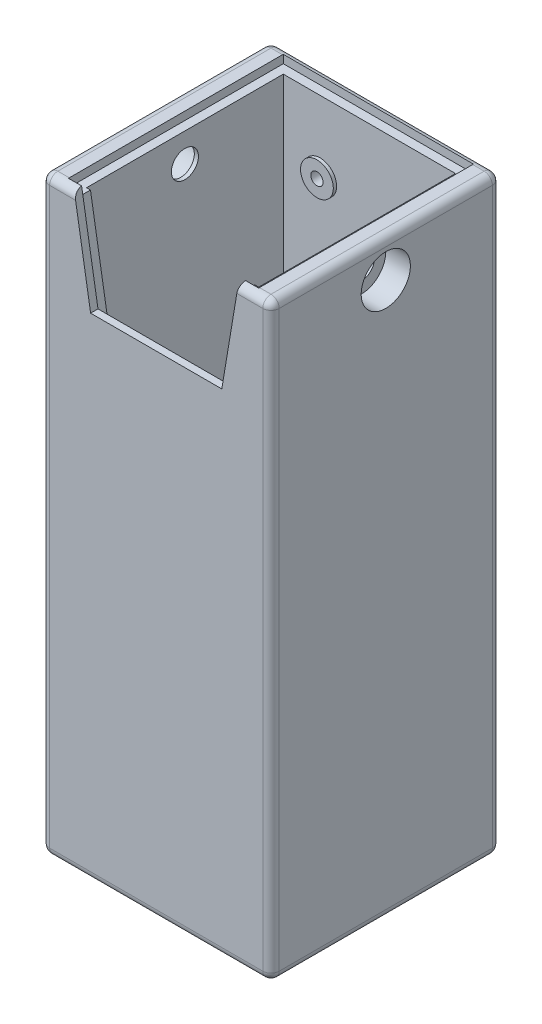
from build123d import *

# Parameters (mm, degrees)
SKIZZE1_W                        = 28
SKIZZE1_H                        = 28
AUFSATZ_LINEAR_AUSTRAGEN1_DEPTH  = 72
SKIZZE2_W                        = 12.2
SKIZZE2_H                        = 10.2
SCHNITT_LINEAR_AUSTRAGEN1_DEPTH  = 53
SKIZZE3_W                        = 21
SKIZZE3_H                        = 24
SCHNITT_LINEAR_AUSTRAGEN2_DEPTH  = 44
SKIZZE6_R                        = 1.25
SCHNITT_LINEAR_AUSTRAGEN4_DEPTH  = 6
SCHNITT_LINEAR_AUSTRAGEN13_DEPTH = 2
SKIZZE7_W                        = 23.2
SKIZZE7_H                        = 26.2
SCHNITT_LINEAR_AUSTRAGEN5_DEPTH  = 1
SCHNITT_LINEAR_AUSTRAGEN14_DEPTH = 1.1
SKIZZE13_R                       = 3
SCHNITT_LINEAR_AUSTRAGEN11_DEPTH = 3
SCHNITT_LINEAR_START             = -3
SKIZZE11_R                       = 3
SCHNITT_LINEAR_AUSTRAGEN9_DEPTH  = 3
SKIZZE12_R                       = 1.625
SCHNITT_LINEAR_AUSTRAGEN10_DEPTH = 0.5
SKIZZE14_R                       = 1.65
SCHNITT_LINEAR_AUSTRAGEN12_DEPTH = 0.5
SKIZZE18_R                       = 2
AUFSATZ_LINEAR_AUSTRAGEN2_DEPTH  = 0.4
SKIZZE19_R                       = 0.75
SCHNITT_LINEAR_AUSTRAGEN15_DEPTH = 1.6
KREISMUSTER1_COUNT               = 4
VERRUNDUNG1_R                    = 1


with BuildPart() as part:
    # Skizze1 → Aufsatz-Linear austragen1 (new body)
    with BuildSketch(Plane(origin=(0, 0, 0), x_dir=(1, 0, 0), z_dir=(0, 1, 0))):
        Rectangle(SKIZZE1_W, SKIZZE1_H)
    extrude(amount=AUFSATZ_LINEAR_AUSTRAGEN1_DEPTH)

    # Skizze2 → Schnitt-Linear austragen1 (cut)
    with BuildSketch(Plane(origin=(0, 72, 0), x_dir=(1, 0, 0), z_dir=(0, 1, 0))):
        Rectangle(SKIZZE2_W, SKIZZE2_H)
    extrude(amount=-SCHNITT_LINEAR_AUSTRAGEN1_DEPTH, mode=Mode.SUBTRACT)

    # Skizze3 → Schnitt-Linear austragen2 (cut)
    with BuildSketch(Plane(origin=(0, 72, 0), x_dir=(1, 0, 0), z_dir=(0, 1, 0))):
        Rectangle(SKIZZE3_W, SKIZZE3_H)
    extrude(amount=-SCHNITT_LINEAR_AUSTRAGEN2_DEPTH, mode=Mode.SUBTRACT)

    # Skizze5 → Schnitt-Rotation1 (revolve, cut)
    with BuildSketch(Plane.XY, mode=Mode.PRIVATE) as schnitt_rotation1_sk:
        Polygon((-3, 0), (-3, 8), (-4.1, 8), (-4.1, 19), (0, 19), (0, 0), align=None)
    revolve(schnitt_rotation1_sk.sketch.rotate(Axis((0, 0, 0), (0, 1, 0)), 270), axis=Axis((0, 0, 0), (0, 1, 0)), mode=Mode.SUBTRACT)

    # Skizze6 → Schnitt-Linear austragen4 (cut)
    with BuildSketch(Plane(origin=(0, 28, 0), x_dir=(1, 0, 0), z_dir=(0, 1, 0))):
        with Locations(Location((7.9, 4.6, 0), (0, 0, 270))):
            Circle(SKIZZE6_R)
        with Locations(Location((-7.9, -4.6, 0), (0, 0, 270))):
            Circle(SKIZZE6_R)
    extrude(amount=-SCHNITT_LINEAR_AUSTRAGEN4_DEPTH, mode=Mode.SUBTRACT)

    # Skizze15 → Schnitt-Linear austragen13 (cut)
    with BuildSketch(Plane.XY.offset(14)):
        Polygon((10, 72), (-10, 72), (-8, 60), (8, 60), align=None)
    extrude(amount=-SCHNITT_LINEAR_AUSTRAGEN13_DEPTH, mode=Mode.SUBTRACT)

    # Skizze7 → Schnitt-Linear austragen5 (cut)
    with BuildSketch(Plane(origin=(0, 72, 0), x_dir=(1, 0, 0), z_dir=(0, 1, 0))):
        Rectangle(SKIZZE7_W, SKIZZE7_H)
    extrude(amount=-SCHNITT_LINEAR_AUSTRAGEN5_DEPTH, mode=Mode.SUBTRACT)

    # Skizze17 → Schnitt-Linear austragen14 (cut)
    with BuildSketch(Plane(origin=(0, 0, 12), x_dir=(-1, 0, 0), z_dir=(0, 0, -1))):
        Polygon((-8, 58.9), (-10.016666667, 71), (-9.833333333, 71), (-8, 60), (8, 60), (9.833333333, 71), (10.016666667, 71), (8, 58.9), align=None)
    extrude(amount=-SCHNITT_LINEAR_AUSTRAGEN14_DEPTH, mode=Mode.SUBTRACT)

    # Skizze13 → Schnitt-Linear austragen11 (cut)
    with BuildSketch(Plane.ZY.offset(14)):
        with Locations((0, 67.5)):
            Circle(SKIZZE13_R)
    extrude(amount=-SCHNITT_LINEAR_AUSTRAGEN11_DEPTH, mode=Mode.SUBTRACT)

    # Skizze11 → Schnitt-Linear austragen9 (cut)
    with BuildSketch(Plane(origin=(14, 0, 0), x_dir=(0, 0, -1), z_dir=(1, 0, 0)).offset(SCHNITT_LINEAR_START)):
        with Locations(Location((0, 67.5, 0), (0, 0, 180))):
            Circle(SKIZZE11_R)
    extrude(amount=SCHNITT_LINEAR_AUSTRAGEN9_DEPTH, mode=Mode.SUBTRACT)

    # Skizze12 → Schnitt-Linear austragen10 (cut)
    with BuildSketch(Plane(origin=(11, 0, 0), x_dir=(0, 0, -1), z_dir=(1, 0, 0))):
        with Locations((0, 67.5)):
            Circle(SKIZZE12_R)
    extrude(amount=-SCHNITT_LINEAR_AUSTRAGEN10_DEPTH, mode=Mode.SUBTRACT)

    # Skizze14 → Schnitt-Linear austragen12 (cut)
    with BuildSketch(Plane.ZY.offset(11)):
        with Locations((0, 67.5)):
            Circle(SKIZZE14_R)
    extrude(amount=-SCHNITT_LINEAR_AUSTRAGEN12_DEPTH, mode=Mode.SUBTRACT)

    # Skizze18 → Aufsatz-Linear austragen2 (add)
    with BuildSketch(Plane.XY.offset(-12)):
        with Locations(Location((-6, 62.4, 0), (0, 0, 180))):
            Circle(SKIZZE18_R)
        with Locations(Location((6, 62.4, 0), (0, 0, 180))):
            Circle(SKIZZE18_R)
    extrude(amount=AUFSATZ_LINEAR_AUSTRAGEN2_DEPTH)

    # Skizze19 → Schnitt-Linear austragen15 (cut)
    with BuildSketch(Plane.XY.offset(-11.6)):
        with Locations((-6, 62.4)):
            Circle(SKIZZE19_R)
        with Locations((6, 62.4)):
            Circle(SKIZZE19_R)
    extrude(amount=-SCHNITT_LINEAR_AUSTRAGEN15_DEPTH, mode=Mode.SUBTRACT)

    # Skizze20 → Schnitt-Rotation2 (revolve, cut)
    with BuildSketch(Plane.XY, mode=Mode.PRIVATE) as schnitt_rotation2_sk:
        Polygon((-4.95, 0), (-4.95, 0.8), (-5.45, 0.8), (-5.45, 7), (-4.95, 7), (-4.95, 8.2), (-8, 8.2), (-8, 0), align=None)
    schnitt_rotation2 = revolve(schnitt_rotation2_sk.sketch.rotate(Axis((-8, 8.2, 0), (0, -1, 0)), 90), axis=Axis((-8, 8.2, 0), (0, -1, 0)), mode=Mode.SUBTRACT)

    # Kreismuster1: Schnitt-Rotation2 ×4 about axis
    kreismuster1_axis = Axis((0, 0, 0), (0, 1, 0))
    for i in range(1, KREISMUSTER1_COUNT):
        add(schnitt_rotation2.rotate(kreismuster1_axis, i * 360 / KREISMUSTER1_COUNT), mode=Mode.SUBTRACT)

    # Verrundung1
    # the kernel refuses this fillet: 1 mm, written as the material it takes off along each edge
    with BuildSketch(Plane(origin=(-13, 1, -13), x_dir=(-1, 0, 0), z_dir=(0, 0, -1))) as verrundung1_piece_1_section:
        Polygon((0, 0), (VERRUNDUNG1_R, 0), (VERRUNDUNG1_R, -VERRUNDUNG1_R), (0, -VERRUNDUNG1_R), align=None)
    verrundung1_piece_1 = extrude(amount=VERRUNDUNG1_R, mode=Mode.PRIVATE)
    verrundung1_piece_1 = verrundung1_piece_1 - Plane(origin=(-13, 1, -13), x_dir=(0.7071067811865475, 0.7071067811865475, 0), z_dir=(0, 0, -1)) * Sphere(VERRUNDUNG1_R, mode=Mode.PRIVATE)
    add(verrundung1_piece_1, mode=Mode.SUBTRACT)
    with BuildSketch(Plane(origin=(-13, 1, 13), x_dir=(0, -1, 0), z_dir=(-1, 0, 0))) as verrundung1_piece_2_section:
        Polygon((0, 0), (VERRUNDUNG1_R, 0), (VERRUNDUNG1_R, VERRUNDUNG1_R), (0, VERRUNDUNG1_R), align=None)
    verrundung1_piece_2 = extrude(amount=VERRUNDUNG1_R, mode=Mode.PRIVATE)
    verrundung1_piece_2 = verrundung1_piece_2 - Plane(origin=(-13, 1, 13), x_dir=(0, 0.7071067811865475, -0.7071067811865475), z_dir=(-1, 0, 0)) * Sphere(VERRUNDUNG1_R, mode=Mode.PRIVATE)
    add(verrundung1_piece_2, mode=Mode.SUBTRACT)
    with BuildSketch(Plane(origin=(13, 1, 13), x_dir=(0, -1, 0), z_dir=(1, 0, 0))) as verrundung1_piece_3_section:
        Polygon((0, 0), (VERRUNDUNG1_R, 0), (VERRUNDUNG1_R, -VERRUNDUNG1_R), (0, -VERRUNDUNG1_R), align=None)
    verrundung1_piece_3 = extrude(amount=VERRUNDUNG1_R, mode=Mode.PRIVATE)
    verrundung1_piece_3 = verrundung1_piece_3 - Plane(origin=(13, 1, 13), x_dir=(0, 0.7071067811865475, -0.7071067811865475), z_dir=(1, 0, 0)) * Sphere(VERRUNDUNG1_R, mode=Mode.PRIVATE)
    add(verrundung1_piece_3, mode=Mode.SUBTRACT)
    with BuildSketch(Plane(origin=(13, 1, -13), x_dir=(1, 0, 0), z_dir=(0, 0, -1))) as verrundung1_piece_4_section:
        Polygon((0, 0), (VERRUNDUNG1_R, 0), (VERRUNDUNG1_R, VERRUNDUNG1_R), (0, VERRUNDUNG1_R), align=None)
    verrundung1_piece_4 = extrude(amount=VERRUNDUNG1_R, mode=Mode.PRIVATE)
    verrundung1_piece_4 = verrundung1_piece_4 - Plane(origin=(13, 1, -13), x_dir=(-0.7071067811865475, 0.7071067811865475, 0), z_dir=(0, 0, -1)) * Sphere(VERRUNDUNG1_R, mode=Mode.PRIVATE)
    add(verrundung1_piece_4, mode=Mode.SUBTRACT)
    with BuildSketch(Plane(origin=(13, 71, 13), x_dir=(0, 1, 0), z_dir=(1, 0, 0))) as verrundung1_piece_5_section:
        Polygon((0, 0), (VERRUNDUNG1_R, 0), (VERRUNDUNG1_R, VERRUNDUNG1_R), (0, VERRUNDUNG1_R), align=None)
    verrundung1_piece_5 = extrude(amount=VERRUNDUNG1_R, mode=Mode.PRIVATE)
    verrundung1_piece_5 = verrundung1_piece_5 - Plane(origin=(13, 71, 13), x_dir=(0, -0.7071067811865475, -0.7071067811865475), z_dir=(1, 0, 0)) * Sphere(VERRUNDUNG1_R, mode=Mode.PRIVATE)
    add(verrundung1_piece_5, mode=Mode.SUBTRACT)
    with BuildSketch(Plane(origin=(13, 71, -13), x_dir=(1, 0, 0), z_dir=(0, 0, -1))) as verrundung1_piece_6_section:
        Polygon((0, 0), (VERRUNDUNG1_R, 0), (VERRUNDUNG1_R, -VERRUNDUNG1_R), (0, -VERRUNDUNG1_R), align=None)
    verrundung1_piece_6 = extrude(amount=VERRUNDUNG1_R, mode=Mode.PRIVATE)
    verrundung1_piece_6 = verrundung1_piece_6 - Plane(origin=(13, 71, -13), x_dir=(-0.7071067811865475, -0.7071067811865475, 0), z_dir=(0, 0, -1)) * Sphere(VERRUNDUNG1_R, mode=Mode.PRIVATE)
    add(verrundung1_piece_6, mode=Mode.SUBTRACT)
    with BuildSketch(Plane(origin=(-13, 71, -13), x_dir=(-1, 0, 0), z_dir=(0, 0, -1))) as verrundung1_piece_7_section:
        Polygon((0, 0), (VERRUNDUNG1_R, 0), (VERRUNDUNG1_R, VERRUNDUNG1_R), (0, VERRUNDUNG1_R), align=None)
    verrundung1_piece_7 = extrude(amount=VERRUNDUNG1_R, mode=Mode.PRIVATE)
    verrundung1_piece_7 = verrundung1_piece_7 - Plane(origin=(-13, 71, -13), x_dir=(0.7071067811865475, -0.7071067811865475, 0), z_dir=(0, 0, -1)) * Sphere(VERRUNDUNG1_R, mode=Mode.PRIVATE)
    add(verrundung1_piece_7, mode=Mode.SUBTRACT)
    with BuildSketch(Plane(origin=(-13, 71, 13), x_dir=(0, 1, 0), z_dir=(-1, 0, 0))) as verrundung1_piece_8_section:
        Polygon((0, 0), (VERRUNDUNG1_R, 0), (VERRUNDUNG1_R, -VERRUNDUNG1_R), (0, -VERRUNDUNG1_R), align=None)
    verrundung1_piece_8 = extrude(amount=VERRUNDUNG1_R, mode=Mode.PRIVATE)
    verrundung1_piece_8 = verrundung1_piece_8 - Plane(origin=(-13, 71, 13), x_dir=(0, -0.7071067811865475, -0.7071067811865475), z_dir=(-1, 0, 0)) * Sphere(VERRUNDUNG1_R, mode=Mode.PRIVATE)
    add(verrundung1_piece_8, mode=Mode.SUBTRACT)
    with BuildSketch(Plane(origin=(-14, 0, -13), x_dir=(0, 1, 0), z_dir=(0, 0, 1)), Plane(origin=(14, 0, 13), x_dir=(0, 1, 0), z_dir=(0, 0, -1)), Plane(origin=(13, 0, -14), x_dir=(0, 1, 0), z_dir=(-1, 0, 0))) as verrundung1_piece_9:
        with BuildLine():
            CenterArc((VERRUNDUNG1_R, -VERRUNDUNG1_R), VERRUNDUNG1_R, 90, 90)
            Line((0, -VERRUNDUNG1_R), (0, 0))
            Line((0, 0), (VERRUNDUNG1_R, 0))
        make_face()
    extrude(amount=26, mode=Mode.SUBTRACT)
    with BuildSketch(Plane(origin=(-13, 0, 14), x_dir=(0, 0, -1), z_dir=(1, 0, 0)), Plane(origin=(13, 72, -14), x_dir=(0, -1, 0), z_dir=(-1, 0, 0)), Plane(origin=(14, 72, 13), x_dir=(0, -1, 0), z_dir=(0, 0, -1)), Plane(origin=(-14, 72, -13), x_dir=(0, -1, 0), z_dir=(0, 0, 1))) as verrundung1_piece_10:
        with BuildLine():
            CenterArc((VERRUNDUNG1_R, VERRUNDUNG1_R), VERRUNDUNG1_R, 180, 90)
            Line((0, VERRUNDUNG1_R), (0, 0))
            Line((0, 0), (VERRUNDUNG1_R, 0))
        make_face()
    extrude(amount=26, mode=Mode.SUBTRACT)
    with BuildSketch(Plane(origin=(14, 1, 14), x_dir=(0, 0, -1), z_dir=(0, 1, 0)), Plane(origin=(14, 1, -14), x_dir=(-1, 0, 0), z_dir=(0, 1, 0))) as verrundung1_piece_11:
        with BuildLine():
            CenterArc((VERRUNDUNG1_R, VERRUNDUNG1_R), VERRUNDUNG1_R, 180, 90)
            Line((0, VERRUNDUNG1_R), (0, 0))
            Line((0, 0), (VERRUNDUNG1_R, 0))
        make_face()
    extrude(amount=70, mode=Mode.SUBTRACT)
    with BuildSketch(Plane(origin=(-14, 1, -14), x_dir=(1, 0, 0), z_dir=(0, 1, 0)), Plane(origin=(-14, 1, 14), x_dir=(0, 0, -1), z_dir=(0, 1, 0))) as verrundung1_piece_12:
        with BuildLine():
            CenterArc((VERRUNDUNG1_R, -VERRUNDUNG1_R), VERRUNDUNG1_R, 90, 90)
            Line((0, -VERRUNDUNG1_R), (0, 0))
            Line((0, 0), (VERRUNDUNG1_R, 0))
        make_face()
    extrude(amount=70, mode=Mode.SUBTRACT)
    with BuildSketch(Plane(origin=(7.5, 72, 14), x_dir=(0, 0, -1), z_dir=(1, 0, 0)), Plane(origin=(-13, 72, 14), x_dir=(0, 0, -1), z_dir=(1, 0, 0))) as verrundung1_piece_13:
        with BuildLine():
            CenterArc((VERRUNDUNG1_R, -VERRUNDUNG1_R), VERRUNDUNG1_R, 90, 90)
            Line((0, -VERRUNDUNG1_R), (0, 0))
            Line((0, 0), (VERRUNDUNG1_R, 0))
        make_face()
    extrude(amount=5.5, mode=Mode.SUBTRACT)


solid = part.part
